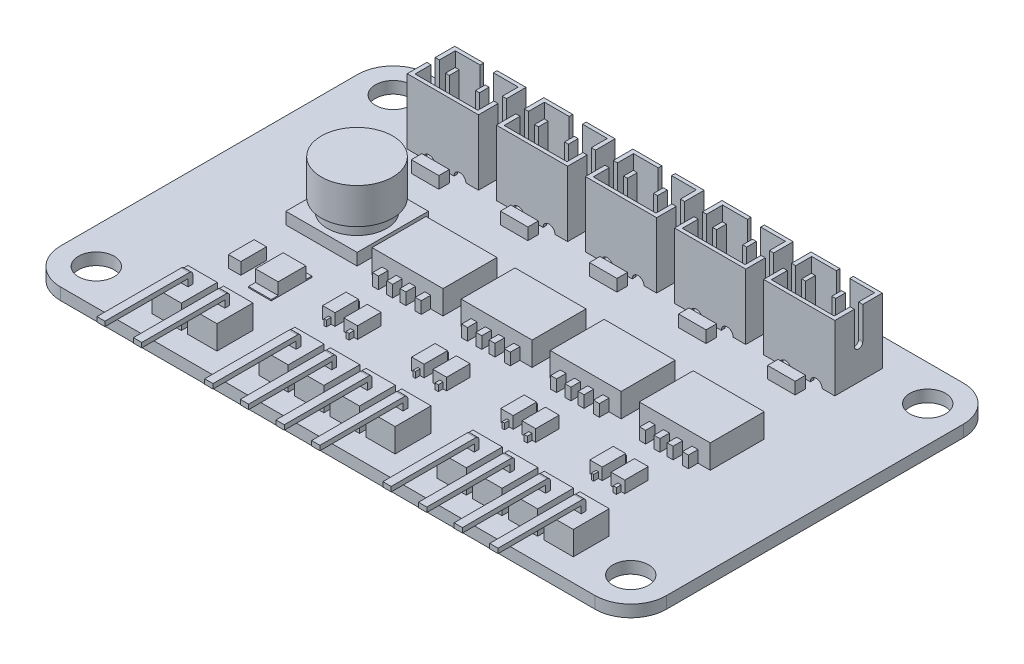
from build123d import *

# Parameters (mm, degrees)
EXTRUDE_1_DEPTH         = 1
CUT_EXTRUDE_1_DEPTH     = 1.5
MIRROR_2_COPY_1_DEPTH   = 1.5
SKETCH_3_W              = 6
SKETCH_3_H              = 4
EXTRUDE_2_DEPTH         = 5.5
SKETCH_4_W              = 5.291704098
SKETCH_4_H              = 3.392137415
CUT_EXTRUDE_2_DEPTH     = 5.5
SKETCH_5_W              = 0.331250981
SKETCH_5_H              = 0.820240525
EXTRUDE_3_DEPTH         = 5.5
CUT_EXTRUDE_6_DEPTH     = 1
CUT_EXTRUDE_7_DEPTH     = 1
CUT_EXTRUDE_8_DEPTH     = 1
PATTERN_LINEAR_1_COUNT  = 5
PATTERN_LINEAR_1_PITCH  = 7.5
PATTERN_LINEAR_2_COUNT  = 5
PATTERN_LINEAR_2_PITCH  = 7.5
PATTERN_LINEAR_3_COUNT  = 5
PATTERN_LINEAR_3_PITCH  = 7.5
PATTERN_LINEAR_4_COUNT  = 5
PATTERN_LINEAR_4_PITCH  = 7.5
PATTERN_LINEAR_5_COUNT  = 5
PATTERN_LINEAR_5_PITCH  = 7.5
PATTERN_LINEAR_6_COUNT  = 5
PATTERN_LINEAR_6_PITCH  = 7.5
SKETCH_9_W              = 6
SKETCH_9_H              = 6
EXTRUDE_4_DEPTH         = 1
SKETCH_11_R             = 2.5
EXTRUDE_5_DEPTH         = 1
SKETCH_12_R             = 3
EXTRUDE_6_DEPTH         = 3
SKETCH_13_W             = 2.316314086
SKETCH_13_H             = 0.884884033
EXTRUDE_7_DEPTH         = 1
PATTERN_LINEAR_7_COUNT  = 5
PATTERN_LINEAR_7_PITCH  = 7.5
SKETCH_14_W             = 5.976836918
SKETCH_14_H             = 4.542396058
EXTRUDE_8_DEPTH         = 2
SKETCH_15_W             = 0.5
SKETCH_15_H             = 0.805308739
EXTRUDE_9_DEPTH         = 1
PATTERN_LINEAR_8_COUNT  = 4
PATTERN_LINEAR_8_PITCH  = 7.5
PATTERN_LINEAR_9_COUNT  = 4
PATTERN_LINEAR_9_PITCH  = 7.5
SKETCH_16_W             = 1.043033164
SKETCH_16_H             = 1.974312773
SKETCH_16_W_2           = 1.154786716
EXTRUDE_10_DEPTH        = 1
SKETCH_17_W             = 0.335896947
SKETCH_17_H             = 0.415657018
SKETCH_17_W_2           = 0.282860586
SKETCH_17_W_3           = 0.191710314
SKETCH_17_H_2           = 0.403278503
SKETCH_17_W_4           = 0.274764433
EXTRUDE_11_DEPTH        = 0.5
PATTERN_LINEAR_10_COUNT = 4
PATTERN_LINEAR_10_PITCH = 7.5
PATTERN_LINEAR_11_COUNT = 4
PATTERN_LINEAR_11_PITCH = 7.5
SKETCH_18_W             = 1.90943661
SKETCH_18_H             = 3.42991391
EXTRUDE_12_DEPTH        = 0.1
SKETCH_19_W             = 1.90943661
SKETCH_19_H             = 2.332591319
EXTRUDE_13_DEPTH        = 1
SKETCH_20_W             = 1.040436416
SKETCH_20_H             = 2.164778994
EXTRUDE_14_DEPTH        = 1
SKETCH_21_W             = 2.470627024
SKETCH_21_H             = 3.027388044
EXTRUDE_15_DEPTH        = 2
SKETCH_22_W             = 0.670627024
SKETCH_22_H             = 0.4
EXTRUDE_16_DEPTH        = 1
SKETCH_23_W             = 0.670627024
SKETCH_23_H             = 0.4
EXTRUDE_17_DEPTH        = 7
FILLET_1_R              = 0.3
PATTERN_LINEAR_12_COUNT = 12
PATTERN_LINEAR_12_PITCH = 3
CUT_EXTRUDE_9_DEPTH     = 1
PATTERN_LINEAR_16_COUNT = 5
PATTERN_LINEAR_16_PITCH = 7.5
EXTRUDE_18_DEPTH        = 0.7
PATTERN_LINEAR_21_COUNT = 12
PATTERN_LINEAR_21_PITCH = 3


with BuildPart() as part:
    # 草图1 → 凸台-拉伸1 (new body)
    with BuildSketch(Plane(origin=(0, 0, 0), x_dir=(1, 0, 0), z_dir=(0, 1, 0))):
        with BuildLine():
            Line((-22.5, 15.5), (22.5, 15.5))
            ThreePointArc((22.5, 15.5), (24.621320344, 14.621320344), (25.5, 12.5))
            Line((25.5, 12.5), (25.5, -12.5))
            ThreePointArc((25.5, -12.5), (24.621320344, -14.621320344), (22.5, -15.5))
            Line((22.5, -15.5), (-22.5, -15.5))
            ThreePointArc((-22.5, -15.5), (-24.621320344, -14.621320344), (-25.5, -12.5))
            Line((-25.5, -12.5), (-25.5, 12.5))
            ThreePointArc((-25.5, 12.5), (-24.621320344, 14.621320344), (-22.5, 15.5))
        make_face()
    extrude(amount=EXTRUDE_1_DEPTH)

    # 草图2 → 切除-拉伸1 (cut)
    with BuildSketch(Plane(origin=(0, 1, 0), x_dir=(1, 0, 0), z_dir=(0, 1, 0))):
        with BuildLine():
            Line((-22.5, 11), (-22.5, 12.5))
            Line((-22.5, 12.5), (-21, 12.5))
            ThreePointArc((-21, 12.5), (-23.560660172, 13.560660172), (-22.5, 11))
        make_face()
        with BuildLine():
            Line((-21, 12.5), (-22.5, 12.5))
            Line((-22.5, 12.5), (-22.5, 11))
            ThreePointArc((-22.5, 11), (-21.439339828, 11.439339828), (-21, 12.5))
        make_face()
    cut_extrude_1 = extrude(amount=-CUT_EXTRUDE_1_DEPTH, mode=Mode.SUBTRACT)

    # 镜向1: 切除-拉伸1 across plane
    add(cut_extrude_1.mirror(Plane.XY), mode=Mode.SUBTRACT)

    # 镜向2: 切除-拉伸1 across plane
    add(cut_extrude_1.mirror(Plane(origin=(0, 0, 0), x_dir=(0, 0, 1), z_dir=(1, 0, 0))), mode=Mode.SUBTRACT)

    # 镜向2 copy 1 sketch → 镜向2 copy 1 (cut)
    with BuildSketch(Plane(origin=(0, 1, 0), x_dir=(-1, 0, 0), z_dir=(0, 1, 0))):
        with BuildLine():
            Line((-22.5, 11), (-22.5, 12.5))
            Line((-22.5, 12.5), (-21, 12.5))
            ThreePointArc((-21, 12.5), (-23.560660172, 13.560660172), (-22.5, 11))
        make_face()
        with BuildLine():
            Line((-21, 12.5), (-22.5, 12.5))
            Line((-22.5, 12.5), (-22.5, 11))
            ThreePointArc((-22.5, 11), (-21.439339828, 11.439339828), (-21, 12.5))
        make_face()
    extrude(amount=-MIRROR_2_COPY_1_DEPTH, mode=Mode.SUBTRACT)

    # 草图3 → 凸台-拉伸2 (add)
    with BuildSketch(Plane(origin=(0, 1, 0), x_dir=(1, 0, 0), z_dir=(0, 1, 0))):
        with Locations((-14.967760399, 11.147246168)):
            Rectangle(SKETCH_3_W, SKETCH_3_H)
    extrude_2 = extrude(amount=EXTRUDE_2_DEPTH)

    # 草图4 → 切除-拉伸2 (cut)
    with BuildSketch(Plane(origin=(0, 6.5, 0), x_dir=(1, 0, 0), z_dir=(0, 1, 0))):
        with Locations((-14.967760399, 11.147246168)):
            Rectangle(SKETCH_4_W, SKETCH_4_H)
    cut_extrude_2 = extrude(amount=-CUT_EXTRUDE_2_DEPTH, mode=Mode.SUBTRACT)

    # 草图5 → 凸台-拉伸3 (add)
    with BuildSketch(Plane(origin=(0, 1, 0), x_dir=(1, 0, 0), z_dir=(0, 1, 0))):
        with Locations((-13.701413256, 11.202229279)):
            Rectangle(SKETCH_5_W, SKETCH_5_H)
        with Locations((-16.234107542, 11.202229279)):
            Rectangle(SKETCH_5_W, SKETCH_5_H)
    extrude_3 = extrude(amount=EXTRUDE_3_DEPTH)

    # 草图6 → 切除-拉伸6 (cut)
    with BuildSketch(Plane.XY.offset(-12.843314875)):
        with BuildLine():
            Line((-14.404086667, 9.379531407), (-14.404086667, 3.620468593))
            ThreePointArc((-14.404086667, 3.620468593), (-14.967760399, 3.056794861), (-15.531434131, 3.620468593))
            Line((-15.531434131, 3.620468593), (-15.531434131, 9.379531407))
            ThreePointArc((-15.531434131, 9.379531407), (-14.967760399, 9.943205139), (-14.404086667, 9.379531407))
        make_face()
    cut_extrude_6 = extrude(amount=-CUT_EXTRUDE_6_DEPTH, mode=Mode.SUBTRACT)

    # 草图7 → 切除-拉伸7 (cut)
    with BuildSketch(Plane(origin=(-11.967760399, 0, 0), x_dir=(0, 0, -1), z_dir=(1, 0, 0))):
        with BuildLine():
            Line((11.501094194, 9.219943494), (11.501094194, 3.780056506))
            ThreePointArc((11.501094194, 3.780056506), (11.147246168, 3.42620848), (10.793398142, 3.780056506))
            Line((10.793398142, 3.780056506), (10.793398142, 9.219943494))
            ThreePointArc((10.793398142, 9.219943494), (11.147246168, 9.57379152), (11.501094194, 9.219943494))
        make_face()
    cut_extrude_7 = extrude(amount=-CUT_EXTRUDE_7_DEPTH, mode=Mode.SUBTRACT)

    # 草图8 → 切除-拉伸8 (cut)
    with BuildSketch(Plane(origin=(-17.613612448, 0, 0), x_dir=(0, 0, -1), z_dir=(1, 0, 0))):
        with BuildLine():
            Line((11.501094194, 3.780056506), (11.501094194, 6.5))
            Line((11.501094194, 6.5), (10.793398142, 6.5))
            Line((10.793398142, 6.5), (10.793398142, 3.780056506))
            ThreePointArc((10.793398142, 3.780056506), (11.147246168, 3.42620848), (11.501094194, 3.780056506))
        make_face()
    cut_extrude_8 = extrude(amount=-CUT_EXTRUDE_8_DEPTH, mode=Mode.SUBTRACT)

    # 阵列(线性)1: 凸台-拉伸2 ×5
    with Locations(*[(i * PATTERN_LINEAR_1_PITCH, 0, 0) for i in range(1, PATTERN_LINEAR_1_COUNT)]):
        add(extrude_2)

    # 阵列(线性)2: 切除-拉伸2 ×5
    with Locations(*[(i * PATTERN_LINEAR_2_PITCH, 0, 0) for i in range(1, PATTERN_LINEAR_2_COUNT)]):
        add(cut_extrude_2, mode=Mode.SUBTRACT)

    # 阵列(线性)3: 凸台-拉伸3 ×5
    with Locations(*[(i * PATTERN_LINEAR_3_PITCH, 0, 0) for i in range(1, PATTERN_LINEAR_3_COUNT)]):
        add(extrude_3)

    # 阵列(线性)4: 切除-拉伸7 ×5
    with Locations(*[(i * PATTERN_LINEAR_4_PITCH, 0, 0) for i in range(1, PATTERN_LINEAR_4_COUNT)]):
        add(cut_extrude_7, mode=Mode.SUBTRACT)

    # 阵列(线性)5: 切除-拉伸6 ×5
    with Locations(*[(i * PATTERN_LINEAR_5_PITCH, 0, 0) for i in range(1, PATTERN_LINEAR_5_COUNT)]):
        add(cut_extrude_6, mode=Mode.SUBTRACT)

    # 阵列(线性)6: 切除-拉伸8 ×5
    with Locations(*[(i * PATTERN_LINEAR_6_PITCH, 0, 0) for i in range(1, PATTERN_LINEAR_6_COUNT)]):
        add(cut_extrude_8, mode=Mode.SUBTRACT)

    # 草图9 → 凸台-拉伸4 (add)
    with BuildSketch(Plane(origin=(0, 1, 0), x_dir=(1, 0, 0), z_dir=(0, 1, 0))):
        with Locations((-14.545363317, 1.505407547)):
            Rectangle(SKETCH_9_W, SKETCH_9_H)
    extrude(amount=EXTRUDE_4_DEPTH)

    # 草图11 → 凸台-拉伸5 (add)
    with BuildSketch(Plane(origin=(0, 2, 0), x_dir=(1, 0, 0), z_dir=(0, 1, 0))):
        with Locations(Location((-14.542419346, 1.494930091, 0), (0, 0, 270))):
            Circle(SKETCH_11_R)
    extrude(amount=EXTRUDE_5_DEPTH)

    # 草图12 → 凸台-拉伸6 (add)
    with BuildSketch(Plane(origin=(0, 3, 0), x_dir=(1, 0, 0), z_dir=(0, 1, 0))):
        with Locations(Location((-14.542419346, 1.494930091, 0), (0, 0, 270))):
            Circle(SKETCH_12_R)
    extrude(amount=EXTRUDE_6_DEPTH)

    # 草图13 → 凸台-拉伸7 (add)
    with BuildSketch(Plane(origin=(0, 1, 0), x_dir=(1, 0, 0), z_dir=(0, 1, 0))):
        with Locations((-14.866665823, 7.988534764)):
            Rectangle(SKETCH_13_W, SKETCH_13_H)
    extrude_7 = extrude(amount=EXTRUDE_7_DEPTH)

    # 阵列(线性)7: 凸台-拉伸7 ×5
    with Locations(*[(i * PATTERN_LINEAR_7_PITCH, 0, 0) for i in range(1, PATTERN_LINEAR_7_COUNT)]):
        add(extrude_7)

    # 草图14 → 凸台-拉伸8 (add)
    with BuildSketch(Plane(origin=(0, 1, 0), x_dir=(1, 0, 0), z_dir=(0, 1, 0))):
        with Locations((-7.278040691, 0.752085972)):
            Rectangle(SKETCH_14_W, SKETCH_14_H)
    extrude_8 = extrude(amount=EXTRUDE_8_DEPTH)

    # 草图15 → 凸台-拉伸9 (add)
    with BuildSketch(Plane(origin=(0, 1, 0), x_dir=(1, 0, 0), z_dir=(0, 1, 0))):
        with Locations((-9.173470967, 3.425938371)):
            Rectangle(SKETCH_15_W, SKETCH_15_H)
        with Locations((-7.971845718, 3.425938371)):
            Rectangle(SKETCH_15_W, SKETCH_15_H)
        with Locations((-6.862298557, 3.425938371)):
            Rectangle(SKETCH_15_W, SKETCH_15_H)
        with Locations((-5.571960645, 3.425938371)):
            Rectangle(SKETCH_15_W, SKETCH_15_H)
        with Locations((-5.571960645, -1.921766427)):
            Rectangle(SKETCH_15_W, SKETCH_15_H)
        with Locations((-6.862298557, -1.921766427)):
            Rectangle(SKETCH_15_W, SKETCH_15_H)
        with Locations((-7.971845718, -1.921766427)):
            Rectangle(SKETCH_15_W, SKETCH_15_H)
        with Locations((-9.173470967, -1.921766427)):
            Rectangle(SKETCH_15_W, SKETCH_15_H)
    extrude_9 = extrude(amount=EXTRUDE_9_DEPTH)

    # 阵列(线性)8: 凸台-拉伸9 ×4
    with Locations(*[(i * PATTERN_LINEAR_8_PITCH, 0, 0) for i in range(1, PATTERN_LINEAR_8_COUNT)]):
        add(extrude_9)

    # 阵列(线性)9: 凸台-拉伸8 ×4
    with Locations(*[(i * PATTERN_LINEAR_9_PITCH, 0, 0) for i in range(1, PATTERN_LINEAR_9_COUNT)]):
        add(extrude_8)

    # 草图16 → 凸台-拉伸10 (add)
    with BuildSketch(Plane(origin=(0, 1, 0), x_dir=(1, 0, 0), z_dir=(0, 1, 0))):
        with Locations((-8.596251918, -5.840841925)):
            Rectangle(SKETCH_16_W, SKETCH_16_H)
        with Locations((-6.75231829, -5.840841925)):
            Rectangle(SKETCH_16_W_2, SKETCH_16_H)
    extrude_10 = extrude(amount=EXTRUDE_10_DEPTH)

    # 草图17 → 凸台-拉伸11 (add)
    with BuildSketch(Plane(origin=(0, 1, 0), x_dir=(1, 0, 0), z_dir=(0, 1, 0))):
        with Locations((-8.572490077, -4.645857029)):
            Rectangle(SKETCH_17_W, SKETCH_17_H)
        with Locations((-6.760414444, -4.645857029)):
            Rectangle(SKETCH_17_W_2, SKETCH_17_H)
        with Locations((-8.500396761, -7.029637562)):
            Rectangle(SKETCH_17_W_3, SKETCH_17_H_2)
        with Locations((-6.614936074, -7.029637562)):
            Rectangle(SKETCH_17_W_4, SKETCH_17_H_2)
    extrude_11 = extrude(amount=EXTRUDE_11_DEPTH)

    # 阵列(线性)10: 凸台-拉伸11 ×4
    with Locations(*[(i * PATTERN_LINEAR_10_PITCH, 0, 0) for i in range(1, PATTERN_LINEAR_10_COUNT)]):
        add(extrude_11)

    # 阵列(线性)11: 凸台-拉伸10 ×4
    with Locations(*[(i * PATTERN_LINEAR_11_PITCH, 0, 0) for i in range(1, PATTERN_LINEAR_11_COUNT)]):
        add(extrude_10)

    # 草图18 → 凸台-拉伸12 (add)
    with BuildSketch(Plane(origin=(0, 1, 0), x_dir=(1, 0, 0), z_dir=(0, 1, 0))):
        with Locations((-13.579408707, -5.935612213)):
            Rectangle(SKETCH_18_W, SKETCH_18_H)
    extrude(amount=EXTRUDE_12_DEPTH)

    # 草图19 → 凸台-拉伸13 (add)
    with BuildSketch(Plane(origin=(0, 1.1, 0), x_dir=(1, 0, 0), z_dir=(0, 1, 0))):
        with Locations((-13.579408707, -5.899527244)):
            Rectangle(SKETCH_19_W, SKETCH_19_H)
    extrude(amount=EXTRUDE_13_DEPTH)

    # 草图20 → 凸台-拉伸14 (add)
    with BuildSketch(Plane(origin=(0, 1, 0), x_dir=(1, 0, 0), z_dir=(0, 1, 0))):
        with Locations((-16.292125171, -5.983433406)):
            Rectangle(SKETCH_20_W, SKETCH_20_H)
    extrude(amount=EXTRUDE_14_DEPTH)

    # 草图21 → 凸台-拉伸15 (add)
    with BuildSketch(Plane(origin=(0, 1, 0), x_dir=(1, 0, 0), z_dir=(0, 1, 0))):
        with Locations((-15.480638467, -12.082377698)):
            Rectangle(SKETCH_21_W, SKETCH_21_H)
    extrude_15 = extrude(amount=EXTRUDE_15_DEPTH)

    # 草图22 → 凸台-拉伸16 (add)
    with BuildSketch(Plane(origin=(0, 3, 0), x_dir=(1, 0, 0), z_dir=(0, 1, 0))):
        with Locations((-15.480638467, -11.928333383)):
            Rectangle(SKETCH_22_W, SKETCH_22_H)
    extrude(amount=EXTRUDE_16_DEPTH)

    # 草图23 → 凸台-拉伸17 (add)
    with BuildSketch(Plane.XY.offset(12.128333383)):
        with Locations((-15.480638467, 3.8)):
            Rectangle(SKETCH_23_W, SKETCH_23_H)
    extrude(amount=EXTRUDE_17_DEPTH)

    # 圆角1
    fillet_1_edges = [part.edges().sort_by_distance(p)[0] for p in [
        (-15.480638467, 4, 11.728333383),
    ]]
    fillet(fillet_1_edges, radius=FILLET_1_R)

    # 阵列(线性)12: 凸台-拉伸15 ×12, 2 skipped
    with Locations(*[(i * PATTERN_LINEAR_12_PITCH, 0, 0) for i in range(1, PATTERN_LINEAR_12_COUNT) if i not in (2, 7)]):
        add(extrude_15)

    # 草图24 → 切除-拉伸9 (cut)
    with BuildSketch(Plane.XY.offset(-9.147246168)):
        with BuildLine():
            ThreePointArc((-13.031203435, 1), (-13.531203435, 1.5), (-14.031203435, 1))
            Line((-14.031203435, 1), (-13.031203435, 1))
        make_face()
        with BuildLine():
            Line((-16.628622772, 1), (-16.517822093, 1))
            Line((-16.517822093, 1), (-15.628622772, 1))
            ThreePointArc((-15.628622772, 1), (-16.128622772, 1.5), (-16.628622772, 1))
        make_face()
    cut_extrude_9 = extrude(amount=-CUT_EXTRUDE_9_DEPTH, mode=Mode.SUBTRACT)

    # 阵列(线性)16: 切除-拉伸9 ×5
    with Locations(*[(i * PATTERN_LINEAR_16_PITCH, 0, 0) for i in range(1, PATTERN_LINEAR_16_COUNT)]):
        add(cut_extrude_9, mode=Mode.SUBTRACT)

    # 草图25 → 凸台-拉伸18 (add)
    with BuildSketch(Plane(origin=(-12.045324955, 0, 0), x_dir=(0, 0, -1), z_dir=(1, 0, 0))):
        with BuildLine():
            Line((-11.728333383, 3), (-11.728333383, 3.7))
            ThreePointArc((-11.728333383, 3.7), (-11.816201349, 3.912132034), (-12.028333383, 4))
            Line((-12.028333383, 4), (-19.128333383, 4))
            Line((-19.128333383, 4), (-19.128333383, 3.6))
            Line((-19.128333383, 3.6), (-12.128333383, 3.6))
            Line((-12.128333383, 3.6), (-12.128333383, 3))
            Line((-12.128333383, 3), (-11.728333383, 3))
        make_face()
    extrude_18 = extrude(amount=-EXTRUDE_18_DEPTH)

    # 阵列(线性)21: 凸台-拉伸18 ×12, 3 skipped
    with Locations(*[(i * PATTERN_LINEAR_21_PITCH, 0, 0) for i in range(1, PATTERN_LINEAR_21_COUNT) if i not in (1, 6, 11)]):
        add(extrude_18)


solid = part.part
